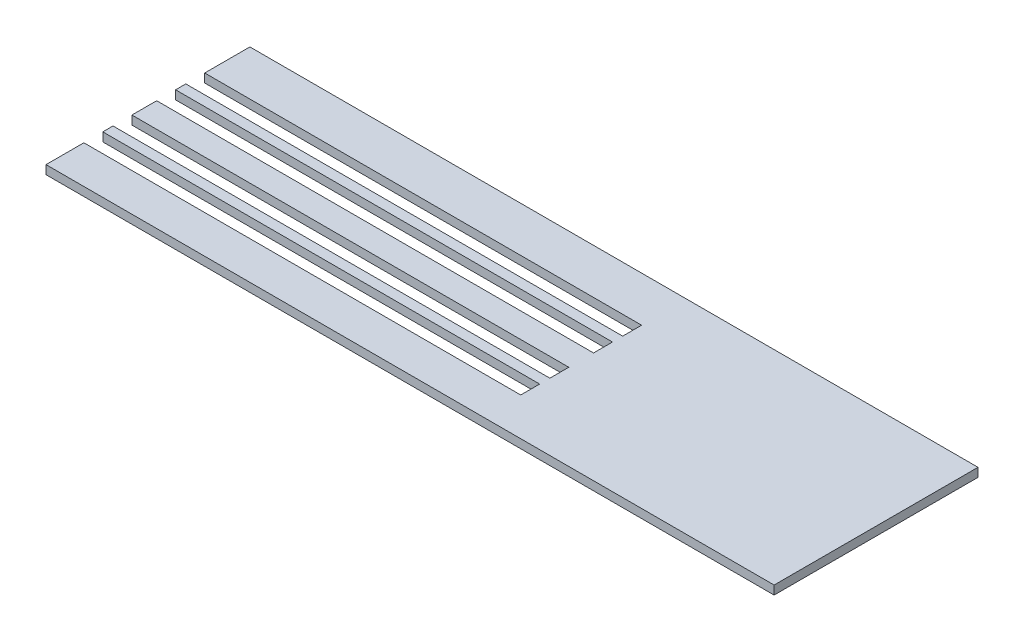
from build123d import *

# Parameters (mm, degrees)
BOSS_EXTRUDE1_DEPTH = 3


with BuildPart() as part:
    # Sketch1 → Boss-Extrude1 (new body)
    with BuildSketch(Plane(origin=(0, 0, 0), x_dir=(1, 0, 0), z_dir=(0, 1, 0))):
        Polygon((-150, 29.5), (0, 29.5), (0, 23), (-150, 23), (-150, 19.5), (0, 19.5), (0, 13), (-150, 13), (-150, 0), (0, 0), (100, 0), (100, 70), (-50, 70), (-150, 70), (-150, 54.5), (0, 54.5), (0, 48), (-150, 48), (-150, 44.5), (0, 44.5), (0, 38), (-150, 38), align=None)
    extrude(amount=BOSS_EXTRUDE1_DEPTH)


solid = part.part
